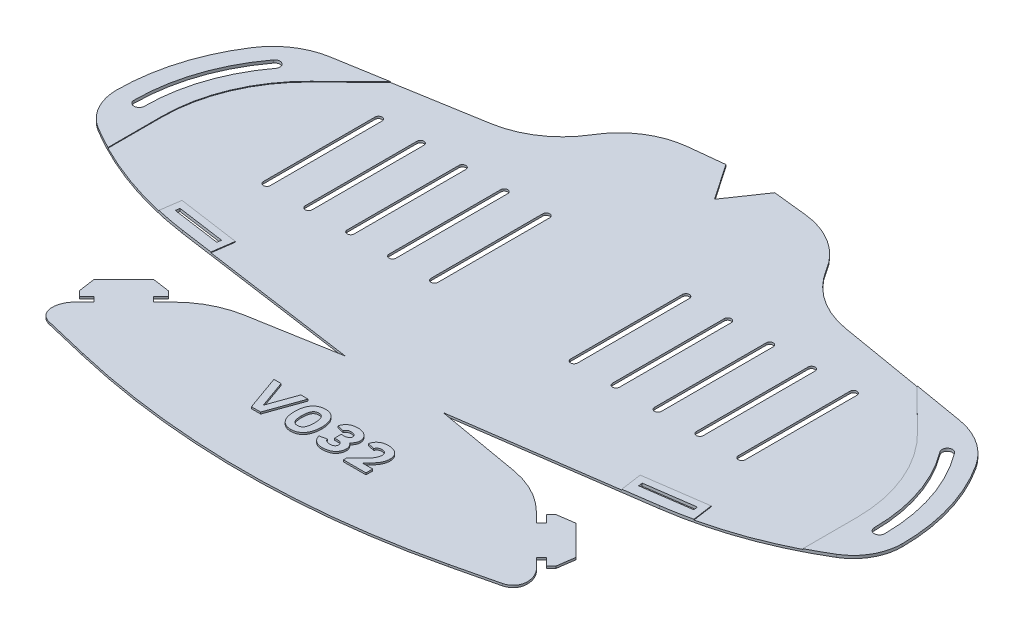
from build123d import *

# Parameters (mm, degrees)
MAIN_SHAPE_DEPTH                   = 0.6
ELASTIC_ATTACHMENT_POINTS_DEPTH    = 184.525502315
REINFORCED_ATTACHMENT_POINTS_DEPTH = 0.2
TAB_SLITS_DEPTH                    = 184.525502315
REINFORCED_TAB_SLITS_DEPTH         = 0.2
BREATHING_SLITS_DEPTH              = 184.525502315
VERSION_NUMBER_DEPTH               = 0.5


with BuildPart() as part:
    # Sketch1 → Main Shape (new body)
    with BuildSketch(Plane(origin=(0, 0, 0), x_dir=(1, 0, 0), z_dir=(0, 1, 0))):
        with BuildLine():
            Line((0, -10.235233266), (-7, 0))
            Line((-7, 0), (-16.941855461, -1.076805455))
            ThreePointArc((-16.941855461, -1.076805455), (-26.448172688, -4.42923559), (-33.461443341, -11.669600897))
            ThreePointArc((-33.461443341, -11.669600897), (-40.804108255, -19.481824954), (-50.74391922, -23.5))
            Line((-50.74391922, -23.5), (-90.180351554, -30.190874742))
            ThreePointArc((-90.180351554, -30.190874742), (-97.811505455, -33.190405434), (-103.597722286, -39))
            ThreePointArc((-103.597722286, -39), (-110.227482046, -53.35351039), (-112.5, -69))
            ThreePointArc((-112.5, -69), (-110.685143325, -75.893640703), (-105.711102551, -81))
            ThreePointArc((-105.711102551, -81), (-87.655491519, -89.524485559), (-68.266232563, -94.291935705))
            Line((-68.266232563, -94.291935705), (-14, -102))
            Line((-14, -102), (-38.626554922, -106.304973016))
            ThreePointArc((-38.626554922, -106.304973016), (-45.849449199, -108.748014338), (-52, -113.254607005))
            Line((-52, -113.254607005), (-54.828307349, -116.0831539))
            Line((-54.828307349, -116.0831539), (-56.242580797, -114.669000226))
            Line((-56.242580797, -114.669000226), (-54.121350285, -112.547590054))
            Line((-54.121350285, -112.547590054), (-55.535623732, -111.13343638))
            Line((-55.535623732, -111.13343638), (-60.48540114, -110.426539202))
            Line((-60.48540114, -110.426539202), (-68.970323187, -118.912179887))
            Line((-68.970323187, -118.912179887), (-68.263006804, -123.861897408))
            Line((-68.263006804, -123.861897408), (-66.848733357, -125.276051082))
            Line((-66.848733357, -125.276051082), (-64.727502845, -123.154640911))
            Line((-64.727502845, -123.154640911), (-63.313229397, -124.568794586))
            Line((-63.313229397, -124.568794586), (-66.141536747, -127.397341481))
            ThreePointArc((-66.141536747, -127.397341481), (-67.550417669, -129.506025763), (-68.045148042, -131.993340924))
            ThreePointArc((-68.045148042, -131.993340924), (-67.183295285, -134.473669911), (-64.9691321, -135.885159709))
            Line((-64.9691321, -135.885159709), (-52.436095294, -138.860716087))
            ThreePointArc((-52.436095294, -138.860716087), (-26.397134772, -143.459954927), (0, -145))
            ThreePointArc((0, -145), (26.397134772, -143.459954927), (52.436095294, -138.860716087))
            Line((52.436095294, -138.860716087), (64.9691321, -135.885159709))
            ThreePointArc((64.9691321, -135.885159709), (67.183295285, -134.473669911), (68.045148042, -131.993340924))
            ThreePointArc((68.045148042, -131.993340924), (67.550417669, -129.506025763), (66.141536747, -127.397341481))
            Line((66.141536747, -127.397341481), (63.313229397, -124.568794586))
            Line((63.313229397, -124.568794586), (64.727502845, -123.154640911))
            Line((64.727502845, -123.154640911), (66.848733357, -125.276051082))
            Line((66.848733357, -125.276051082), (68.263006804, -123.861897408))
            Line((68.263006804, -123.861897408), (68.970323187, -118.912179887))
            Line((68.970323187, -118.912179887), (60.48540114, -110.426539202))
            Line((60.48540114, -110.426539202), (55.535623732, -111.13343638))
            Line((55.535623732, -111.13343638), (54.121350285, -112.547590054))
            Line((54.121350285, -112.547590054), (56.242580797, -114.669000226))
            Line((56.242580797, -114.669000226), (54.828307349, -116.0831539))
            Line((54.828307349, -116.0831539), (52, -113.254607005))
            ThreePointArc((52, -113.254607005), (45.849449199, -108.748014338), (38.626554922, -106.304973016))
            Line((38.626554922, -106.304973016), (14, -102))
            Line((14, -102), (68.266232563, -94.291935705))
            ThreePointArc((68.266232563, -94.291935705), (87.655491519, -89.524485559), (105.711102551, -81))
            ThreePointArc((105.711102551, -81), (110.685143325, -75.893640703), (112.5, -69))
            ThreePointArc((112.5, -69), (110.227482046, -53.35351039), (103.597722286, -39))
            ThreePointArc((103.597722286, -39), (97.811505455, -33.190405434), (90.180351554, -30.190874742))
            Line((90.180351554, -30.190874742), (50.74391922, -23.5))
            ThreePointArc((50.74391922, -23.5), (40.804108255, -19.481824954), (33.461443341, -11.669600897))
            ThreePointArc((33.461443341, -11.669600897), (26.448172688, -4.42923559), (16.941855461, -1.076805455))
            Line((16.941855461, -1.076805455), (7, 0))
            Line((7, 0), (0, -10.235233266))
        make_face()
    extrude(amount=MAIN_SHAPE_DEPTH)

    # Sketch2 → Elastic Attachment Points (cut, through all)
    with BuildSketch(Plane(origin=(0, 0.6, 0), x_dir=(1, 0, 0), z_dir=(0, 1, 0))):
        with BuildLine():
            ThreePointArc((-97.5, -39), (-104.934164903, -53.188611699), (-107.5, -69))
            ThreePointArc((-107.5, -69), (-106, -70.5), (-104.5, -69))
            ThreePointArc((-104.5, -69), (-102.088115008, -54.137294997), (-95.1, -40.8))
            ThreePointArc((-95.1, -40.8), (-95.4, -38.7), (-97.5, -39))
        make_face()
        with BuildLine():
            ThreePointArc((97.5, -39), (104.934164903, -53.188611699), (107.5, -69))
            ThreePointArc((107.5, -69), (106, -70.5), (104.5, -69))
            ThreePointArc((104.5, -69), (102.088115008, -54.137294997), (95.1, -40.8))
            ThreePointArc((95.1, -40.8), (95.4, -38.7), (97.5, -39))
        make_face()
    extrude(amount=-ELASTIC_ATTACHMENT_POINTS_DEPTH, mode=Mode.SUBTRACT)

    # Sketch7 → Reinforced Attachment Points (add)
    # profile 1 of 2: a face of its own
    with BuildSketch(Plane(origin=(0, 0.6, 0), x_dir=(1, 0, 0), z_dir=(0, 1, 0))):
        with BuildLine():
            Line((-99.5, -69), (-99.5, -84.438405623))
            ThreePointArc((-99.5, -84.438405623), (-102.636073846, -82.774338486), (-105.711102551, -81))
            ThreePointArc((-105.711102551, -81), (-110.685143325, -75.893640703), (-112.5, -69))
            ThreePointArc((-112.5, -69), (-110.227482046, -53.35351039), (-103.597722286, -39))
            ThreePointArc((-103.597722286, -39), (-97.811505455, -33.190405434), (-90.180351554, -30.190874742))
            Line((-90.180351554, -30.190874742), (-75.331937335, -27.671659038))
            Line((-75.331937335, -27.671659038), (-86.893876913, -39))
            ThreePointArc((-86.893876913, -39), (-96.22042633, -52.729517991), (-99.5, -69))
        make_face()
        with BuildLine():
            ThreePointArc((-107.5, -69), (-106, -70.5), (-104.5, -69))
            ThreePointArc((-104.5, -69), (-102.088115008, -54.137294997), (-95.1, -40.8))
            ThreePointArc((-95.1, -40.8), (-95.4, -38.7), (-97.5, -39))
            ThreePointArc((-97.5, -39), (-104.934164903, -53.188611699), (-107.5, -69))
        make_face(mode=Mode.SUBTRACT)
    # profile 2 of 2: a face of its own
    with BuildSketch(Plane(origin=(0, 0.6, 0), x_dir=(1, 0, 0), z_dir=(0, 1, 0))):
        with BuildLine():
            Line((75.331937335, -27.671659038), (90.180351554, -30.190874742))
            ThreePointArc((90.180351554, -30.190874742), (97.811505455, -33.190405434), (103.597722286, -39))
            ThreePointArc((103.597722286, -39), (110.227482046, -53.35351039), (112.5, -69))
            ThreePointArc((112.5, -69), (110.685143325, -75.893640703), (105.711102551, -81))
            ThreePointArc((105.711102551, -81), (102.636073846, -82.774338486), (99.5, -84.438405623))
            Line((99.5, -84.438405623), (99.5, -69))
            ThreePointArc((99.5, -69), (96.22042633, -52.729517991), (86.893876913, -39))
            Line((86.893876913, -39), (75.331937335, -27.671659038))
        make_face()
        with BuildLine():
            ThreePointArc((104.5, -69), (106, -70.5), (107.5, -69))
            ThreePointArc((107.5, -69), (104.934164903, -53.188611699), (97.5, -39))
            ThreePointArc((97.5, -39), (95.4, -38.7), (95.1, -40.8))
            ThreePointArc((95.1, -40.8), (102.088115008, -54.137294997), (104.5, -69))
        make_face(mode=Mode.SUBTRACT)
    extrude(amount=REINFORCED_ATTACHMENT_POINTS_DEPTH)

    # Sketch6 → Tab Slits (cut, through all)
    with BuildSketch(Plane(origin=(0, 0.6, 0), x_dir=(1, 0, 0), z_dir=(0, 1, 0))):
        Polygon((-74.249122325, -90.412003663), (-60.388251326, -92.380824416), (-60.219495261, -91.192749759), (-74.08036626, -89.223929006), align=None)
        Polygon((74.249122325, -90.412003663), (74.08036626, -89.223929006), (60.219495261, -91.192749759), (60.388251326, -92.380824416), align=None)
    extrude(amount=-TAB_SLITS_DEPTH, mode=Mode.SUBTRACT)

    # Sketch9 → Reinforced Tab Slits (add)
    # profile 1 of 2: a face of its own
    with BuildSketch(Plane(origin=(0, 0.6, 0), x_dir=(1, 0, 0), z_dir=(0, 1, 0))):
        with BuildLine():
            Line((-58.830017059, -95.632271166), (-57.958110725, -89.493885438))
            Line((-57.958110725, -89.493885438), (-75.779230581, -86.96254447))
            Line((-75.779230581, -86.96254447), (-76.600612621, -92.745229602))
            ThreePointArc((-76.600612621, -92.745229602), (-72.449818634, -93.606932243), (-68.266232563, -94.291935705))
            Line((-68.266232563, -94.291935705), (-58.830017059, -95.632271166))
        make_face()
        Polygon((-60.388251326, -92.380824416), (-60.219495261, -91.192749759), (-74.08036626, -89.223929006), (-74.249122325, -90.412003663), align=None, mode=Mode.SUBTRACT)
    # profile 2 of 2: a face of its own
    with BuildSketch(Plane(origin=(0, 0.6, 0), x_dir=(1, 0, 0), z_dir=(0, 1, 0))):
        with BuildLine():
            Line((68.266232563, -94.291935705), (58.830017059, -95.632271166))
            Line((58.830017059, -95.632271166), (57.958110725, -89.493885438))
            Line((57.958110725, -89.493885438), (75.779230581, -86.96254447))
            Line((75.779230581, -86.96254447), (76.600612621, -92.745229602))
            ThreePointArc((76.600612621, -92.745229602), (72.449818634, -93.606932243), (68.266232563, -94.291935705))
        make_face()
        Polygon((60.219495261, -91.192749759), (74.08036626, -89.223929006), (74.249122325, -90.412003663), (60.388251326, -92.380824416), align=None, mode=Mode.SUBTRACT)
    extrude(amount=REINFORCED_TAB_SLITS_DEPTH)

    # Sketch3 → Breathing Slits (cut, through all)
    with BuildSketch(Plane(origin=(0, 0.6, 0), x_dir=(1, 0, 0), z_dir=(0, 1, 0))):
        with BuildLine():
            Line((-19, -38.45), (-19, -70.45))
            ThreePointArc((-19, -70.45), (-20, -71.45), (-21, -70.45))
            Line((-21, -70.45), (-21, -38.45))
            ThreePointArc((-21, -38.45), (-20, -37.45), (-19, -38.45))
        make_face()
        with BuildLine():
            Line((-31, -38.45), (-31, -70.45))
            ThreePointArc((-31, -70.45), (-32, -71.45), (-33, -70.45))
            Line((-33, -70.45), (-33, -38.45))
            ThreePointArc((-33, -38.45), (-32, -37.45), (-31, -38.45))
        make_face()
        with BuildLine():
            Line((-43, -38.45), (-43, -70.45))
            ThreePointArc((-43, -70.45), (-44, -71.45), (-45, -70.45))
            Line((-45, -70.45), (-45, -38.45))
            ThreePointArc((-45, -38.45), (-44, -37.45), (-43, -38.45))
        make_face()
        with BuildLine():
            Line((-55, -38.45), (-55, -70.45))
            ThreePointArc((-55, -70.45), (-56, -71.45), (-57, -70.45))
            Line((-57, -70.45), (-57, -38.45))
            ThreePointArc((-57, -38.45), (-56, -37.45), (-55, -38.45))
        make_face()
        with BuildLine():
            Line((-67, -38.45), (-67, -70.45))
            ThreePointArc((-67, -70.45), (-68, -71.45), (-69, -70.45))
            Line((-69, -70.45), (-69, -38.45))
            ThreePointArc((-69, -38.45), (-68, -37.45), (-67, -38.45))
        make_face()
        with BuildLine():
            Line((19, -38.45), (19, -70.45))
            ThreePointArc((19, -70.45), (20, -71.45), (21, -70.45))
            Line((21, -70.45), (21, -38.45))
            ThreePointArc((21, -38.45), (20, -37.45), (19, -38.45))
        make_face()
        with BuildLine():
            Line((31, -38.45), (31, -70.45))
            ThreePointArc((31, -70.45), (32, -71.45), (33, -70.45))
            Line((33, -70.45), (33, -38.45))
            ThreePointArc((33, -38.45), (32, -37.45), (31, -38.45))
        make_face()
        with BuildLine():
            Line((43, -38.45), (43, -70.45))
            ThreePointArc((43, -70.45), (44, -71.45), (45, -70.45))
            Line((45, -70.45), (45, -38.45))
            ThreePointArc((45, -38.45), (44, -37.45), (43, -38.45))
        make_face()
        with BuildLine():
            Line((55, -38.45), (55, -70.45))
            ThreePointArc((55, -70.45), (56, -71.45), (57, -70.45))
            Line((57, -70.45), (57, -38.45))
            ThreePointArc((57, -38.45), (56, -37.45), (55, -38.45))
        make_face()
        with BuildLine():
            Line((67, -38.45), (67, -70.45))
            ThreePointArc((67, -70.45), (68, -71.45), (69, -70.45))
            Line((69, -70.45), (69, -38.45))
            ThreePointArc((69, -38.45), (68, -37.45), (67, -38.45))
        make_face()
    extrude(amount=-BREATHING_SLITS_DEPTH, mode=Mode.SUBTRACT)

    # Sketch8 → Version Number (add)
    # profile 1 of 4: a face of its own
    with BuildSketch(Plane(origin=(0, 0.6, 0), x_dir=(1, 0, 0), z_dir=(0, 1, 0))):
        Polygon((-14.353036684, -128.5), (-11.718116049, -128.5), (-8.146687478, -118.5), (-10.210179541, -118.5), (-13.035576367, -126.420634921), (-15.860973192, -118.5), (-17.924465256, -118.5), align=None)
    # profile 2 of 4: a face of its own
    with BuildSketch(Plane(origin=(0, 0.6, 0), x_dir=(1, 0, 0), z_dir=(0, 1, 0))):
        with BuildLine():
            add(Edge.make_bspline(
                [(-3.124512798, -118.5), (-3.268878762, -118.505695671), (-3.55163391, -118.51685121), (-3.964768911, -118.5745591), (-4.352611614, -118.680335178), (-4.71981319, -118.819656178), (-5.062088761, -119.003303471), (-5.385881936, -119.221085059), (-5.678892551, -119.487440084), (-5.954347604, -119.785519386), (-6.200210785, -120.12453761), (-6.413646494, -120.500892889), (-6.595609271, -120.912503383), (-6.744530434, -121.360169436), (-6.860079483, -121.844506854), (-6.947833422, -122.364485904), (-6.999387861, -122.921030718), (-7.010044591, -123.303893775), (-7.015523173, -123.500722112)],
                knots=[0, 0, 0, 0, 0.970159994, 1.900155169, 2.79438565, 3.665191596, 4.532301255, 5.397946305, 6.279238358, 7.185391655, 8.120220805, 9.085107467, 10.08639026, 11.138349125, 12.249459105, 13.427760297, 14.677622047, 16, 16, 16, 16], degree=3))
            add(Edge.make_bspline(
                [(-7.015523173, -123.500722112), (-7.010099782, -123.69832053), (-6.999591155, -124.081196856), (-6.947624086, -124.637697099), (-6.860178196, -125.156966907), (-6.744068339, -125.641884177), (-6.596125676, -126.090648826), (-6.413579051, -126.502814664), (-6.200268747, -126.879260377), (-5.954187566, -127.218032326), (-5.679795829, -127.51659595), (-5.384328283, -127.779877259), (-5.06297704, -128.000979952), (-4.719619736, -128.183632701), (-4.353066681, -128.324409639), (-3.964113602, -128.425104033), (-3.552335281, -128.488808035), (-3.269553908, -128.496221224), (-3.125409832, -128.5)],
                knots=[0, 0, 0, 0, 1.327400251, 2.57203543, 3.750234214, 4.861247624, 5.917991082, 6.919186852, 7.883989653, 8.818737555, 9.724812096, 10.602616666, 11.47109776, 12.338132057, 13.208862319, 14.101698703, 15.032365954, 16, 16, 16, 16], degree=3))
            add(Edge.make_bspline(
                [(-3.125409832, -128.5), (-2.981270164, -128.496210687), (-2.698497434, -128.488776824), (-2.28665702, -128.425221319), (-1.897234689, -128.323813307), (-1.529873211, -128.184839888), (-1.187483731, -128.000200623), (-0.866437325, -127.779984633), (-0.571038656, -127.516566079), (-0.296628857, -127.218040576), (-0.05054823, -126.879258594), (0.162744512, -126.502813072), (0.345366389, -126.090657611), (0.493004127, -125.641847927), (0.610316977, -125.157235462), (0.692759124, -124.637275213), (0.750415349, -124.081441513), (0.758325717, -123.698369528), (0.762407101, -123.500722112)],
                knots=[0, 0, 0, 0, 0.96765053, 1.898333634, 2.791185227, 3.666728435, 4.529238626, 5.397734515, 6.275554038, 7.181644014, 8.116407839, 9.081227075, 10.082439899, 11.139201358, 12.250233695, 13.427610983, 14.672766316, 16, 16, 16, 16], degree=3))
            add(Edge.make_bspline(
                [(0.762407101, -123.500722112), (0.758266271, -123.303845261), (0.750209566, -122.920787111), (0.692965588, -122.364907693), (0.610217393, -121.844238468), (0.493467757, -121.360205444), (0.344849792, -120.912494629), (0.162811975, -120.500894477), (-0.050606202, -120.124539393), (-0.296468797, -119.785511139), (-0.571942034, -119.487469991), (-0.864883242, -119.220977415), (-1.188368104, -119.004075275), (-1.529679752, -118.818455332), (-1.897690316, -118.680915067), (-2.286006948, -118.574534625), (-2.698856026, -118.516562336), (-2.981340857, -118.506550382), (-3.125409832, -118.501444225)],
                knots=[0, 0, 0, 0, 1.322391154, 2.572941942, 3.750582404, 4.861863084, 5.913983562, 6.915420183, 7.880455081, 8.815427849, 9.721720359, 10.603147806, 11.468925845, 12.331628829, 13.207367743, 14.101735605, 15.031873656, 16, 16, 16, 16], degree=3))
            Line((-3.125409832, -118.501444225), (-3.124512798, -118.5))
        make_face()
        with BuildLine():
            add(Edge.make_bspline(
                [(-3.124512798, -126.579365079), (-3.193832346, -126.580142247), (-3.329842672, -126.581667111), (-3.527295909, -126.549518886), (-3.713747004, -126.50001124), (-3.887924299, -126.424863461), (-4.05171966, -126.32888552), (-4.202335203, -126.207295998), (-4.340694226, -126.063513987), (-4.468009284, -125.896932623), (-4.581880587, -125.703005633), (-4.680411576, -125.478827118), (-4.761148991, -125.222713054), (-4.830325749, -124.937433189), (-4.881577114, -124.621763618), (-4.920080679, -124.276117752), (-4.945947343, -123.899148475), (-4.949306618, -123.63702081), (-4.951053342, -123.500722112)],
                knots=[0, 0, 0, 0, 0.820209436, 1.609314487, 2.362064528, 3.101854642, 3.850272983, 4.605479342, 5.3882482, 6.210255141, 7.084711649, 8.047345167, 9.106040688, 10.263495908, 11.523832392, 12.893430008, 14.384674726, 16, 16, 16, 16], degree=3))
            add(Edge.make_bspline(
                [(-4.951053342, -123.500722112), (-4.949299731, -123.364424703), (-4.945927212, -123.102299516), (-4.920151567, -122.725313211), (-4.881258593, -122.378974061), (-4.830962309, -122.063111109), (-4.760744886, -121.778059679), (-4.680441854, -121.522619394), (-4.581911694, -121.298401339), (-4.467877035, -121.104640769), (-4.341486731, -120.937923887), (-4.201524245, -120.796456824), (-4.051803493, -120.674830172), (-3.887963609, -120.578630118), (-3.713317589, -120.50465551), (-3.527950042, -120.450210023), (-3.329806333, -120.423926373), (-3.19436306, -120.422146526), (-3.125409832, -120.421240419)],
                knots=[0, 0, 0, 0, 1.616177311, 3.108208617, 4.478528655, 5.748482895, 6.897727805, 7.956981757, 8.920123036, 9.795040793, 10.617481319, 11.394165711, 12.149770419, 12.898583529, 13.63876386, 14.394368568, 15.182584207, 16, 16, 16, 16], degree=3))
            add(Edge.make_bspline(
                [(-3.125409832, -120.421240419), (-3.056458197, -120.422149219), (-2.921018053, -120.423934355), (-2.722851832, -120.450179948), (-2.537565245, -120.504762296), (-2.363231898, -120.577982734), (-2.201006563, -120.675595023), (-2.051536805, -120.796360516), (-1.911636558, -120.937948802), (-1.785272246, -121.104645093), (-1.671047509, -121.298351736), (-1.573262228, -121.523063414), (-1.48930237, -121.777554553), (-1.420113271, -122.063195246), (-1.369483592, -122.378948588), (-1.330691478, -122.725320897), (-1.304885814, -123.102297333), (-1.301517662, -123.364423957), (-1.299766323, -123.500722112)],
                knots=[0, 0, 0, 0, 0.817669415, 1.606129616, 2.361968767, 3.102378757, 3.843623451, 4.599462602, 5.376387978, 6.199083685, 7.074272906, 8.037713021, 9.100132017, 10.249733507, 11.520081779, 12.89082699, 14.383321233, 16, 16, 16, 16], degree=3))
            add(Edge.make_bspline(
                [(-1.299766323, -123.500722112), (-1.301510776, -123.637021556), (-1.304865684, -123.899150658), (-1.33076236, -124.276110066), (-1.36916531, -124.621789015), (-1.420748529, -124.937349474), (-1.488890394, -125.223220708), (-1.573291906, -125.478383327), (-1.671078761, -125.703055181), (-1.78513994, -125.896928348), (-1.912429082, -126.063488884), (-2.050725173, -126.207393621), (-2.201089262, -126.328120602), (-2.363270489, -126.425517476), (-2.537135739, -126.499891817), (-2.723505077, -126.549600883), (-2.920694706, -126.581404352), (-3.056393241, -126.580608552), (-3.125409832, -126.580203806)],
                knots=[0, 0, 0, 0, 1.616177474, 3.108208932, 4.478529109, 5.739530511, 6.897596372, 7.959685938, 8.922827315, 9.797745161, 10.620185771, 11.403367596, 12.15897238, 12.899987232, 13.640167639, 14.39331481, 15.182836171, 16, 16, 16, 16], degree=3))
            Line((-3.125409832, -126.580203806), (-3.124512798, -126.579365079))
        make_face(mode=Mode.SUBTRACT)
    # profile 3 of 4: a face of its own
    with BuildSketch(Plane(origin=(0, 0.6, 0), x_dir=(1, 0, 0), z_dir=(0, 1, 0))):
        with BuildLine():
            Line((6.198092009, -124.404761905), (6.293330104, -124.404761905))
            add(Edge.make_bspline(
                [(6.293330104, -124.404761905), (6.393597999, -124.411299477), (6.584233201, -124.423729091), (6.850899497, -124.486416557), (7.083693586, -124.578961335), (7.275380964, -124.709274647), (7.429026265, -124.861365804), (7.543353704, -125.032278467), (7.613014948, -125.222537651), (7.621890385, -125.355662585), (7.626367416, -125.422814713)],
                knots=[0, 0, 0, 0, 1.293250512, 2.458803691, 3.516087315, 4.504014474, 5.424976382, 6.287022232, 7.135923681, 8, 8, 8, 8], degree=3))
            add(Edge.make_bspline(
                [(7.626367416, -125.422814713), (7.623077866, -125.504440638), (7.61671688, -125.662280257), (7.547569508, -125.887718235), (7.429214651, -126.087113891), (7.294298814, -126.23073656), (7.165134159, -126.331172702), (7.050245163, -126.395688771), (6.921394263, -126.450185226), (6.778366257, -126.49595932), (6.621644798, -126.532200484), (6.450685861, -126.560253509), (6.264862139, -126.575366879), (6.136023143, -126.5785552), (6.069403517, -126.580203806)],
                knots=[0, 0, 0, 0, 1.334208421, 2.579951764, 3.816761299, 5.103436918, 5.78324123, 6.491044783, 7.25516555, 8.072210043, 8.94833879, 9.888551629, 10.908219533, 12, 12, 12, 12], degree=3))
            add(Edge.make_bspline(
                [(6.069403517, -126.580203806), (5.995009926, -126.579024673), (5.844525333, -126.576639503), (5.617878787, -126.537785365), (5.389603829, -126.472292557), (5.16250643, -126.384048723), (4.948349829, -126.26078738), (4.771027301, -126.088542309), (4.629857545, -125.87591894), (4.575288391, -125.712337396), (4.546885722, -125.62719493)],
                knots=[0, 0, 0, 0, 0.920255672, 1.861508472, 2.836752399, 3.857684402, 4.873720033, 5.872631744, 6.892727297, 8, 8, 8, 8], degree=3))
            Line((4.546885722, -125.62719493), (2.563171374, -126.071428571))
            add(Edge.make_bspline(
                [(2.563171374, -126.071428571), (2.586006658, -126.160336196), (2.630962803, -126.335369884), (2.723971682, -126.586847228), (2.83540912, -126.824009097), (2.960565463, -127.050933458), (3.10871655, -127.26169635), (3.272885089, -127.459934114), (3.452116619, -127.647890635), (3.652448911, -127.819546753), (3.86989589, -127.976110236), (4.107042463, -128.112422888), (4.361607961, -128.230322428), (4.637145351, -128.322934743), (4.929262966, -128.399729339), (5.240531536, -128.45295857), (5.569362514, -128.491934936), (5.795244006, -128.497268097), (5.910951439, -128.5)],
                knots=[0, 0, 0, 0, 0.97897001, 1.927311989, 2.855460552, 3.773345826, 4.68872018, 5.599601379, 6.518067916, 7.456260856, 8.41049365, 9.372940738, 10.370680865, 11.39871829, 12.470472684, 13.590411754, 14.765692276, 16, 16, 16, 16], degree=3))
            add(Edge.make_bspline(
                [(5.910951439, -128.5), (6.067221325, -128.494245394), (6.369747375, -128.483104934), (6.807556164, -128.435865678), (7.213204546, -128.358387224), (7.586979338, -128.252017359), (7.931853032, -128.123277608), (8.242838452, -127.961059217), (8.524929888, -127.774497038), (8.772583909, -127.55815064), (8.986978622, -127.319870658), (9.178736196, -127.071551477), (9.336525488, -126.805353082), (9.469056142, -126.527874631), (9.567683766, -126.234513517), (9.639147469, -125.928607165), (9.680819871, -125.607680152), (9.685937504, -125.38925418), (9.68854084, -125.278141077)],
                knots=[0, 0, 0, 0, 1.338573179, 2.591371041, 3.766159492, 4.869841347, 5.915366975, 6.911991706, 7.866279139, 8.804635322, 9.718527085, 10.607232931, 11.486170613, 12.362759498, 13.235296616, 14.130311397, 15.048891017, 16, 16, 16, 16], degree=3))
            add(Edge.make_bspline(
                [(9.68854084, -125.278141077), (9.683192413, -125.181448476), (9.672665654, -124.991138356), (9.617350068, -124.713321084), (9.52499018, -124.451246621), (9.395798442, -124.20784025), (9.244598736, -123.977552327), (9.06946732, -123.764837772), (8.875070274, -123.566155092), (8.730645608, -123.449574998), (8.657454128, -123.39049458)],
                knots=[0, 0, 0, 0, 1.042147361, 2.051151675, 3.039496243, 4.024119517, 5.012016893, 6.002285516, 6.987598979, 8, 8, 8, 8], degree=3))
            add(Edge.make_bspline(
                [(8.657454128, -123.39049458), (8.730635163, -123.325162044), (8.874995919, -123.19628365), (9.069268042, -122.981710509), (9.243438747, -122.755542958), (9.396794499, -122.515248899), (9.523996024, -122.261642739), (9.616820113, -121.993228321), (9.672728376, -121.711764564), (9.683213764, -121.519933272), (9.68854084, -121.42247384)],
                knots=[0, 0, 0, 0, 1.026734164, 2.025389794, 3.025877614, 4.013273499, 5.006315215, 5.989929209, 6.978788314, 8, 8, 8, 8], degree=3))
            add(Edge.make_bspline(
                [(9.68854084, -121.42247384), (9.684458975, -121.322020203), (9.676439995, -121.124675201), (9.629497298, -120.835115028), (9.554319283, -120.558271626), (9.446877226, -120.294880847), (9.31346163, -120.042407113), (9.148649716, -119.803370965), (8.957620538, -119.574583887), (8.736789679, -119.361344215), (8.490090521, -119.166999953), (8.218282305, -118.995833154), (7.923743615, -118.84746887), (7.602967562, -118.730513446), (7.261051945, -118.632405283), (6.895172109, -118.562780212), (6.506096954, -118.515976725), (6.238708863, -118.506371293), (6.101553214, -118.501444225)],
                knots=[0, 0, 0, 0, 0.933249724, 1.833404674, 2.71837752, 3.592513965, 4.4704886, 5.365912677, 6.284554944, 7.234984132, 8.212272519, 9.196674926, 10.214289296, 11.269589965, 12.363543901, 13.515449053, 14.72555956, 16, 16, 16, 16], degree=3))
            add(Edge.make_bspline(
                [(6.101553214, -118.501444225), (5.988160862, -118.504384419), (5.766980103, -118.510119502), (5.444195833, -118.546209564), (5.138366528, -118.597359567), (4.849547802, -118.671164203), (4.578504245, -118.76520159), (4.324782162, -118.877770477), (4.088252628, -119.009217236), (3.870649359, -119.161041577), (3.670388783, -119.328960798), (3.488991795, -119.510905494), (3.324244802, -119.704452098), (3.179710626, -119.91288512), (3.05008115, -120.132286581), (2.943546121, -120.36651166), (2.848627163, -120.610059019), (2.805222945, -120.780460499), (2.7832452, -120.866743363)],
                knots=[0, 0, 0, 0, 1.229240767, 2.397731417, 3.51786287, 4.588673614, 5.625367482, 6.624717489, 7.594406979, 8.554388623, 9.496885304, 10.424058211, 11.336820069, 12.248524965, 13.170856983, 14.095351914, 15.035580601, 16, 16, 16, 16], degree=3))
            Line((2.7832452, -120.866743363), (4.690155501, -121.373015873))
            add(Edge.make_bspline(
                [(4.690155501, -121.373015873), (4.701453151, -121.326631527), (4.725969327, -121.22597637), (4.816470454, -121.081457089), (4.938319128, -120.927147787), (5.099531903, -120.771324055), (5.296909676, -120.625559671), (5.534999654, -120.514206488), (5.808084041, -120.446844288), (6.000913479, -120.430020784), (6.101553214, -120.421240419)],
                knots=[0, 0, 0, 0, 0.626586808, 1.359708585, 2.222843852, 3.223153095, 4.308434095, 5.447412619, 6.667777482, 8, 8, 8, 8], degree=3))
            add(Edge.make_bspline(
                [(6.101553214, -120.421240419), (6.1735862, -120.423218633), (6.311821689, -120.42701494), (6.509225011, -120.449676308), (6.689516639, -120.474391788), (6.850566044, -120.515621967), (6.996181051, -120.558109891), (7.120790238, -120.618078056), (7.231551572, -120.680273756), (7.34645526, -120.780934624), (7.460783251, -120.912654377), (7.563777203, -121.077310889), (7.623774218, -121.24921056), (7.625513286, -121.365405566), (7.626367416, -121.42247384)],
                knots=[0, 0, 0, 0, 1.26888152, 2.435057415, 3.499383416, 4.470882074, 5.362320585, 6.164854387, 6.902680001, 7.591682225, 8.843898063, 9.963361673, 10.999720905, 12, 12, 12, 12], degree=3))
            add(Edge.make_bspline(
                [(7.626367416, -121.42247384), (7.621296662, -121.49199044), (7.611218464, -121.630155711), (7.535939651, -121.827940252), (7.414414338, -122.008163808), (7.251087592, -122.171288708), (7.043751683, -122.307565764), (6.796214708, -122.408872593), (6.509334374, -122.47003825), (6.305479531, -122.480300003), (6.198002305, -122.485710249)],
                knots=[0, 0, 0, 0, 0.842573162, 1.674626639, 2.532888499, 3.465967991, 4.458251597, 5.524776888, 6.695002246, 8, 8, 8, 8], degree=3))
            Line((6.198002305, -122.485710249), (5.340949152, -122.484126984))
            Line((5.340949152, -122.484126984), (5.340949152, -124.404761905))
            Line((5.340949152, -124.404761905), (6.198092009, -124.404761905))
        make_face()
    # profile 4 of 4: a face of its own
    with BuildSketch(Plane(origin=(0, 0.6, 0), x_dir=(1, 0, 0), z_dir=(0, 1, 0))):
        with BuildLine():
            Line((18.448978951, -126.579365079), (15.480724983, -126.579365079))
            Line((15.480724983, -126.579365079), (16.480724983, -125.579365079))
            add(Edge.make_bspline(
                [(16.480724983, -125.579365079), (16.623258002, -125.435101948), (16.904512687, -125.150433303), (17.281272668, -124.693877148), (17.621400807, -124.228877799), (17.872007262, -123.829278657), (18.04550508, -123.500008431), (18.15843927, -123.246183665), (18.255245955, -122.984860872), (18.332745009, -122.715154547), (18.395353852, -122.438403207), (18.440454661, -122.153805288), (18.471903881, -121.861768592), (18.476743782, -121.664444299), (18.47918657, -121.56485107)],
                knots=[0, 0, 0, 0, 1.582570997, 3.122823812, 4.615792444, 6.07845684, 6.800172901, 7.519807657, 8.24584061, 8.973961103, 9.709013445, 10.459618703, 11.222541005, 12, 12, 12, 12], degree=3))
            add(Edge.make_bspline(
                [(18.47918657, -121.56485107), (18.475402354, -121.452127389), (18.468004607, -121.231764352), (18.417721279, -120.911326598), (18.343669655, -120.60713083), (18.23385907, -120.321563977), (18.098584864, -120.051733691), (17.93409097, -119.798158257), (17.737813947, -119.564341147), (17.51452569, -119.348254557), (17.266563933, -119.152664175), (16.993827184, -118.982193794), (16.698250561, -118.837069135), (16.380317292, -118.718460118), (16.040320278, -118.622746198), (15.677025045, -118.559191945), (15.292116265, -118.513486883), (15.02782753, -118.505528391), (14.892198944, -118.501444225)],
                knots=[0, 0, 0, 0, 1.019764297, 1.993532827, 2.929308438, 3.84787678, 4.755541458, 5.656627231, 6.576344045, 7.511991459, 8.464008606, 9.428817176, 10.417039143, 11.438566378, 12.495688184, 13.60842439, 14.772683148, 16, 16, 16, 16], degree=3))
            add(Edge.make_bspline(
                [(14.892198944, -118.501444225), (14.776550388, -118.504731189), (14.550181839, -118.511165039), (14.22006676, -118.542535978), (13.908055792, -118.596276475), (13.614145925, -118.665774953), (13.33888903, -118.757886794), (13.082905875, -118.871562794), (12.84373399, -119.001342713), (12.623752457, -119.151574984), (12.424559103, -119.320801377), (12.239491976, -119.500802902), (12.077215107, -119.698408314), (11.927009036, -119.905748922), (11.800344394, -120.130971141), (11.689213195, -120.368710981), (11.596403087, -120.619826819), (11.550985906, -120.794348677), (11.527962791, -120.882818212)],
                knots=[0, 0, 0, 0, 1.237288182, 2.421847195, 3.543086451, 4.621383684, 5.649265595, 6.642689818, 7.613694239, 8.55614632, 9.485995527, 10.406534234, 11.313316084, 12.217506806, 13.141643155, 14.072032899, 15.02266482, 16, 16, 16, 16], degree=3))
            Line((11.527962791, -120.882818212), (13.512471015, -121.373015873))
            add(Edge.make_bspline(
                [(13.512471015, -121.373015873), (13.530131457, -121.313660818), (13.566007253, -121.193085709), (13.660731999, -121.024273028), (13.78838454, -120.866109379), (13.944766698, -120.716952615), (14.136551961, -120.59002378), (14.360902976, -120.494492671), (14.617096311, -120.438465619), (14.797774531, -120.427152683), (14.892198944, -120.421240419)],
                knots=[0, 0, 0, 0, 0.821603693, 1.669023057, 2.553015954, 3.518058165, 4.53170708, 5.594421511, 6.742818376, 8, 8, 8, 8], degree=3))
            add(Edge.make_bspline(
                [(14.892198944, -120.421240419), (15.005870609, -120.426106911), (15.22247777, -120.43538026), (15.527445392, -120.504263654), (15.792364131, -120.616865119), (16.014713601, -120.772700105), (16.191294293, -120.965209606), (16.321914784, -121.190228557), (16.401550566, -121.447139154), (16.411752324, -121.629344082), (16.417013146, -121.723303148)],
                knots=[0, 0, 0, 0, 1.208719883, 2.30327744, 3.306415015, 4.253218101, 5.169797949, 6.063846763, 7.001568439, 8, 8, 8, 8], degree=3))
            add(Edge.make_bspline(
                [(16.417013146, -121.723303148), (16.414388747, -121.841534164), (16.408974023, -122.085471261), (16.331326003, -122.456607682), (16.210725288, -122.843397809), (16.070407917, -123.172040038), (15.933218998, -123.443264128), (15.808214918, -123.651697293), (15.667380025, -123.86351308), (15.510811575, -124.079317691), (15.338408545, -124.300506253), (15.147810225, -124.52439598), (14.941286452, -124.75288648), (14.793330453, -124.901378986), (14.717672017, -124.977311769)],
                knots=[0, 0, 0, 0, 1.128055105, 2.32743062, 3.606916281, 4.996817725, 5.736192845, 6.510253921, 7.317743928, 8.166429697, 9.057590288, 9.997041475, 10.975771781, 12, 12, 12, 12], degree=3))
            Line((14.717672017, -124.977311769), (11.988661491, -127.642857143))
            Line((11.988661491, -127.642857143), (11.988661491, -128.5))
            Line((11.988661491, -128.5), (18.448978951, -128.5))
            Line((18.448978951, -128.5), (18.448978951, -126.579365079))
        make_face()
    extrude(amount=VERSION_NUMBER_DEPTH)


solid = part.part
